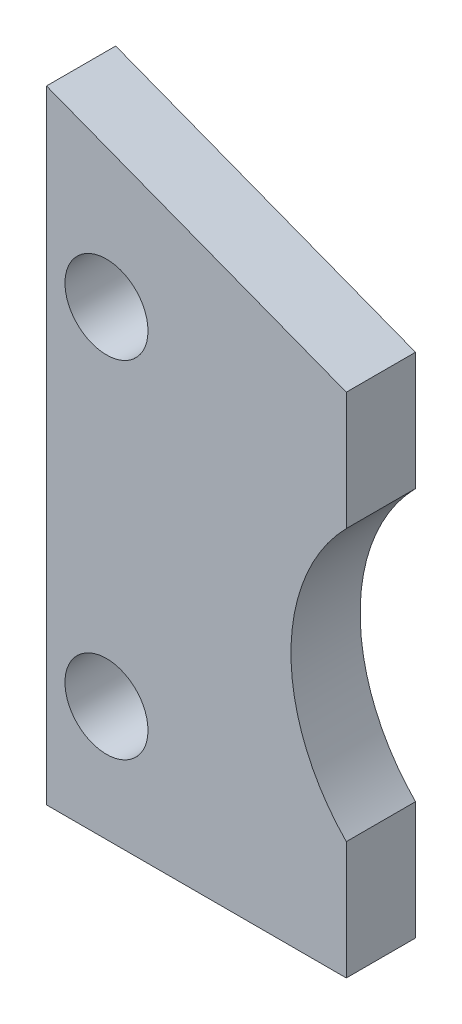
from build123d import *

# Parameters (mm, degrees)
TABAN_FLAN_1_DEPTH    = 15
IZIM2_R               = 9
KES_EKSTR_ZYON1_DEPTH = 151.582203464


# Sheet-metal steps are written as plain solids
with BuildPart() as part:
    # Çizim1 → Taban-Flanş1 (new body)
    with BuildSketch(Plane.XY):
        with BuildLine():
            Line((0, 0), (65, 0))
            Line((65, 0), (65, 25.606123087))
            ThreePointArc((65, 25.606123087), (53, 55), (65, 84.393876913))
            Line((65, 84.393876913), (65, 110))
            Line((65, 110), (0, 135))
            Line((0, 135), (0, 0))
        make_face()
    extrude(amount=-TABAN_FLAN_1_DEPTH)

    # Çizim2 → Kes-Ekstrüzyon1 (cut, through all)
    with BuildSketch(Plane.XY):
        with Locations((13, 100)):
            Circle(IZIM2_R)
        with Locations((13, 25)):
            Circle(IZIM2_R)
    extrude(amount=-KES_EKSTR_ZYON1_DEPTH, mode=Mode.SUBTRACT)


solid = part.part
